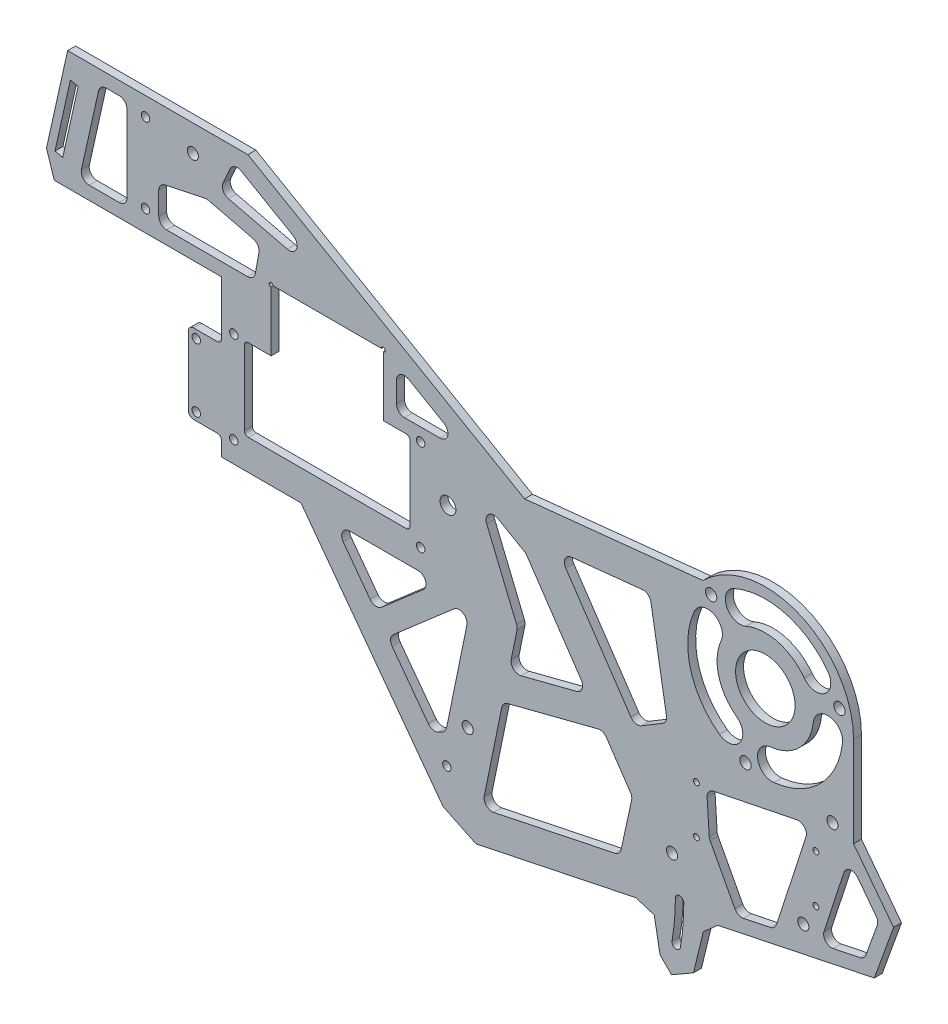
from build123d import *

# Parameters (mm, degrees)
SKETCH1_W           = 184.414327478
SKETCH1_H           = 83.61431582
BOSS_EXTRUDE1_DEPTH = 3
SKETCH2_R           = 3
CUT_EXTRUDE1_DEPTH  = 70
SKETCH3_R           = 11.25
CUT_EXTRUDE2_DEPTH  = 3
SKETCH4_R           = 1.6
BOSS_EXTRUDE2_DEPTH = 3
CUT_EXTRUDE3_DEPTH  = 10
SKETCH6_R           = 1.6
CUT_EXTRUDE4_DEPTH  = 3
FILLET1_R           = 1.5
SKETCH8_R           = 1.6
CUT_EXTRUDE6_DEPTH  = 12
SKETCH9_R           = 2.15
CUT_EXTRUDE7_DEPTH  = 12
BOSS_EXTRUDE3_DEPTH = 3
SKETCH12_R          = 1.6
CUT_EXTRUDE8_DEPTH  = 10
SKETCH13_R          = 1.1
CUT_EXTRUDE9_DEPTH  = 10
CUT_EXTRUDE10_START = -10
CUT_EXTRUDE10_DEPTH = 10
FILLET2_R           = 3
BOSS_EXTRUDE4_DEPTH = 3
SKETCH18_R          = 2.1
CUT_EXTRUDE11_DEPTH = 3
CUT_EXTRUDE12_DEPTH = 3
CUT_EXTRUDE13_DEPTH = 10
BOSS_EXTRUDE5_DEPTH = 3
CUT_EXTRUDE14_DEPTH = 10
BOSS_EXTRUDE7_DEPTH = 3
SKETCH24_W          = 17.029361635
SKETCH24_H          = 15.775010261
CUT_EXTRUDE15_DEPTH = 3
CUT_EXTRUDE16_DEPTH = 3
CUT_EXTRUDE17_DEPTH = 3
BOSS_EXTRUDE8_DEPTH = 3
BOSS_EXTRUDE9_DEPTH = 3
CUT_EXTRUDE18_DEPTH = 3
FILLET3_R           = 3


with BuildPart() as part:
    # Sketch1 → Boss-Extrude1 (new body)
    with BuildSketch(Plane.XY):
        with Locations((112.494062572, 5.79284209)):
            Rectangle(SKETCH1_W, SKETCH1_H)
    extrude(amount=BOSS_EXTRUDE1_DEPTH)

    # Sketch2 → Cut-Extrude1 (cut)
    with BuildSketch(Plane(origin=(0, 0, 0), x_dir=(-1, 0, 0), z_dir=(0, 0, -1))):
        with Locations((-24.116880081, 24)):
            Circle(SKETCH2_R)
    extrude(amount=-CUT_EXTRUDE1_DEPTH, mode=Mode.SUBTRACT)

    # Sketch3 → Cut-Extrude2 (cut)
    with BuildSketch(Plane.XY.offset(3)):
        with Locations((144.116880081, 24)):
            Circle(SKETCH3_R)
    extrude(amount=-CUT_EXTRUDE2_DEPTH, mode=Mode.SUBTRACT)

    # Sketch4 → Boss-Extrude2 (add)
    with BuildSketch(Plane.XY.offset(3)):
        with BuildLine():
            Line((-61.543119919, 56), (-61.543119919, 34))
            Line((-61.543119919, 34), (-72.043119919, 34))
            ThreePointArc((-72.043119919, 34), (-73.457333481, 33.414213562), (-74.043119919, 32))
            Line((-74.043119919, 32), (-74.043119919, 6))
            ThreePointArc((-74.043119919, 6), (-73.457333481, 4.585786438), (-72.043119919, 4))
            Line((-72.043119919, 4), (-61.543119919, 4))
            Line((-61.543119919, 4), (-61.543119919, -26))
            Line((-61.543119919, -26), (34.701226311, -81.566699204))
            Line((34.701226311, -81.566699204), (204.701226311, -81.566699204))
            Line((204.701226311, -81.566699204), (204.701226311, -36.01431582))
            Line((204.701226311, -36.01431582), (20.286898833, -36.01431582))
            Line((20.286898833, -36.01431582), (20.286898833, 47.6))
            Line((20.286898833, 47.6), (40.948393205, 47.6))
            Line((40.948393205, 47.6), (-51.543119919, 101))
            Line((-51.543119919, 101), (-121.543119919, 101))
            Line((-121.543119919, 101), (-121.543119919, 56))
            Line((-121.543119919, 56), (-61.543119919, 56))
        make_face()
        with Locations((-71.043119919, 31)):
            Circle(SKETCH4_R, mode=Mode.SUBTRACT)
        with Locations((-71.043119919, 7)):
            Circle(SKETCH4_R, mode=Mode.SUBTRACT)
    extrude(amount=-BOSS_EXTRUDE2_DEPTH)

    # Sketch5 → Cut-Extrude3 (cut)
    with BuildSketch(Plane.XY.offset(3)):
        with BuildLine():
            Line((-51.373138671, 8.5), (8.286898833, 8.5))
            ThreePointArc((8.286898833, 8.5), (9.347559005, 8.939339828), (9.786898833, 10))
            Line((9.786898833, 10), (9.786898833, 38))
            ThreePointArc((9.786898833, 38), (9.347559005, 39.060660172), (8.286898833, 39.5))
            Line((8.286898833, 39.5), (-0.343119919, 39.5))
            Line((-0.343119919, 39.5), (-0.343119919, 62.05))
            ThreePointArc((-0.343119919, 62.05), (0.187210167, 63.330330086), (-1.093119919, 62.8))
            Line((-1.093119919, 62.8), (-41.993119919, 62.8))
            ThreePointArc((-41.993119919, 62.8), (-43.273450005, 63.330330086), (-42.743119919, 62.05))
            Line((-42.743119919, 62.05), (-42.743119919, 39.5))
            Line((-42.743119919, 39.5), (-51.373138671, 39.5))
            ThreePointArc((-51.373138671, 39.5), (-52.433798843, 39.060660172), (-52.873138671, 38))
            Line((-52.873138671, 38), (-52.873138671, 10))
            ThreePointArc((-52.873138671, 10), (-52.433798843, 8.939339828), (-51.373138671, 8.5))
        make_face()
    extrude(amount=-CUT_EXTRUDE3_DEPTH, mode=Mode.SUBTRACT)

    # Sketch6 → Cut-Extrude4 (cut)
    with BuildSketch(Plane.XY.offset(3)):
        with Locations((13.786898833, 5)):
            Circle(SKETCH6_R)
        with Locations((13.786898833, 39.6)):
            Circle(SKETCH6_R)
        with Locations((-56.873138671, 5)):
            Circle(SKETCH6_R)
        with Locations((-56.873138671, 39.6)):
            Circle(SKETCH6_R)
    extrude(amount=-CUT_EXTRUDE4_DEPTH, mode=Mode.SUBTRACT)

    # Fillet1
    fillet1_edges = [part.edges().sort_by_distance(p)[0] for p in [
        (-61.543119919, 4, 1.5),
        (-61.543119919, 34, 1.5),
    ]]
    fillet(fillet1_edges, radius=FILLET1_R)

    # Sketch8 → Cut-Extrude6 (cut)
    with BuildSketch(Plane.XY.offset(3)):
        with Locations((-90.243119919, 94)):
            Circle(SKETCH8_R)
        with Locations((-90.243119919, 64)):
            Circle(SKETCH8_R)
    extrude(amount=-CUT_EXTRUDE6_DEPTH, mode=Mode.SUBTRACT)

    # Sketch9 → Cut-Extrude7 (cut)
    with BuildSketch(Plane(origin=(0, 0, 0), x_dir=(-1, 0, 0), z_dir=(0, 0, -1))):
        with Locations((-172.128729044, 31.505752308)):
            Circle(SKETCH9_R)
        with Locations((-123.610783427, 44.506096654)):
            Circle(SKETCH9_R)
        with Locations((-136.611127773, -4.011848962)):
            Circle(SKETCH9_R)
    extrude(amount=-CUT_EXTRUDE7_DEPTH, mode=Mode.SUBTRACT)

    # Sketch10 → Boss-Extrude3 (add)
    with BuildSketch(Plane(origin=(0, 0, 0), x_dir=(-1, 0, 0), z_dir=(0, 0, -1))):
        with BuildLine():
            Line((-167.680888654, 47.6), (-120.552871509, 47.6))
            ThreePointArc((-120.552871509, 47.6), (-144.116880081, 57.35), (-167.680888654, 47.6))
        make_face()
    extrude(amount=-BOSS_EXTRUDE3_DEPTH)

    # Sketch12 → Cut-Extrude8 (cut)
    with BuildSketch(Plane.XY.offset(3)):
        with Locations((23.701226311, -61.566699204)):
            Circle(SKETCH12_R)
        with BuildLine():
            ThreePointArc((110.101226311, -61.566699204), (109.784541603, -68.957425033), (108.836808989, -76.293971931))
            ThreePointArc((108.836808989, -76.293971931), (110.140666581, -78.143284068), (111.989978718, -76.839426476))
            ThreePointArc((111.989978718, -76.839426476), (112.97281254, -69.231155619), (113.301226311, -61.566699204))
            ThreePointArc((113.301226311, -61.566699204), (111.701226311, -59.966699204), (110.101226311, -61.566699204))
        make_face()
    extrude(amount=-CUT_EXTRUDE8_DEPTH, mode=Mode.SUBTRACT)

    # Sketch13 → Cut-Extrude9 (cut)
    with BuildSketch(Plane(origin=(0, 0, 0), x_dir=(-1, 0, 0), z_dir=(0, 0, -1))):
        with Locations((-163.256880081, -19.666699204)):
            Circle(SKETCH13_R)
        with Locations((-163.256880081, -37.666699204)):
            Circle(SKETCH13_R)
        with Locations((-118.056880081, -19.666699204)):
            Circle(SKETCH13_R)
        with Locations((-118.056880081, -37.666699204)):
            Circle(SKETCH13_R)
    extrude(amount=-CUT_EXTRUDE9_DEPTH, mode=Mode.SUBTRACT)

    # Sketch16 → Cut-Extrude10 (cut)
    with BuildSketch(Plane.XY.offset(3).offset(CUT_EXTRUDE10_START)):
        with BuildLine():
            Line((185.325635428, -50.178485254), (192.610066917, -29.966985111))
            Line((192.610066917, -29.966985111), (177.466624901, -10.155091534))
            Line((177.466624901, -10.155091534), (177.46688008, 23.999750834))
            ThreePointArc((177.46688008, 23.999750834), (174.923438362, 36.774132726), (167.680888654, 47.6))
            Line((167.680888654, 47.6), (204.701226311, 47.6))
            Line((204.701226311, 47.6), (204.701226311, -81.566699204))
            Line((204.701226311, -81.566699204), (109.015798372, -101.506327194))
            Line((109.015798372, -101.506327194), (-44.901184683, -81.566699204))
            Line((-44.901184683, -81.566699204), (-83.479855962, -7.179423821))
            Line((-83.479855962, -7.179423821), (-61.543119919, 0.5))
            Line((-61.543119919, 0.5), (-10.377615905, -59.783091395))
            Line((-10.377615905, -59.783091395), (34.701226311, -81.566699204))
            Line((34.701226311, -81.566699204), (95.172760947, -68.965199366))
            Line((95.172760947, -68.965199366), (102.113936995, -71.163480303))
            Line((102.113936995, -71.163480303), (104.337885566, -83.247775468))
            Line((104.337885566, -83.247775468), (107.080942415, -86.649887581))
            Line((107.080942415, -86.649887581), (116.929327033, -82.818994447))
            Line((116.929327033, -82.818994447), (120.691367686, -67.292179678))
            Line((120.691367686, -67.292179678), (126.176730317, -62.504365896))
            Line((126.176730317, -62.504365896), (185.325635428, -50.178485254))
        make_face()
        Polygon((181.569463907, -45.853814209), (186.98169326, -30.836956064), (175.587529072, -15.930175425), (164.707665864, -49.367598778), align=None)
        Polygon((147.786240628, -52.893808898), (133.646418373, -55.840368282), (122.940030102, -35.687729471), (121.928442119, -19.944750575), (161.094031546, -11.994559496), align=None)
        Polygon((89.166717868, -57.958999698), (93.826808725, -36.561374232), (82.859070044, -20.334560064), (44.843332342, -30.101550826), (36.922170316, -68.846099909), align=None)
        Polygon((76.913076188, -11.537437872), (47.071209453, -19.204400407), (50.404084791, -2.902404349), (35.32234623, 33.6), (46.404584615, 33.6), align=None)
        Polygon((94.86090031, -13.090702215), (107.087345897, -5.711274922), (100.36312134, 33.6), (63.30255402, 33.6), align=None)
        Polygon((12.323472505, -57.425373854), (22.136022596, -41.32020616), (30.031020571, -2.703632538), (-25.068997653, -30.11082242), (-11.765789474, -45.784634883), align=None)
        Polygon((-31.734510056, -22.257529442), (1.788643564, -5.582844635), (-2.128574469, 0.5), (-41.543119919, 0.5), (-41.543119919, -10.701045514), align=None)
        Polygon((32.317750709, 44.5), (4.656880081, 44.5), (4.656880081, 60.470011103), align=None)
        Polygon((-16.348136015, 72.5972628), (-56.880404544, 95.998578946), (-62.456657233, 83.781845933), align=None)
        Polygon((-49.161692729, 61), (-46.86151067, 73.82491911), (-67.080486661, 78.72945328), (-85.243119919, 74.895250525), (-85.243119919, 61), align=None)
    extrude(amount=CUT_EXTRUDE10_DEPTH, mode=Mode.SUBTRACT)

    # Fillet2
    fillet2_edges = [part.edges().sort_by_distance(p)[0] for p in [
        (175.587529072, -15.930175425, 1.5),
        (186.98169326, -30.836956064, 1.5),
        (164.707665864, -49.367598778, 1.5),
        (181.569463907, -45.853814209, 1.5),
        (121.928442119, -19.944750575, 1.5),
        (122.940030102, -35.687729471, 1.5),
        (133.646418373, -55.840368282, 1.5),
        (147.786240628, -52.893808898, 1.5),
        (94.86090031, -13.090702215, 1.5),
        (63.30255402, 33.6, 1.5),
        (35.32234623, 33.6, 1.5),
        (76.913076188, -11.537437872, 1.5),
        (89.166717868, -57.958999698, 1.5),
        (36.922170316, -68.846099909, 1.5),
        (50.404084791, -2.902404349, 1.5),
        (47.071209453, -19.204400407, 1.5),
        (93.826808725, -36.561374232, 1.5),
        (82.859070044, -20.334560064, 1.5),
        (107.087345897, -5.711274922, 1.5),
        (100.36312134, 33.6, 1.5),
        (161.094031546, -11.994559496, 1.5),
        (46.404584615, 33.6, 1.5),
        (30.031020571, -2.703632538, 1.5),
        (-25.068997653, -30.11082242, 1.5),
        (22.136022596, -41.32020616, 1.5),
        (12.323472505, -57.425373854, 1.5),
        (-11.765789474, -45.784634883, 1.5),
        (-41.543119919, -10.701045514, 1.5),
        (-31.734510056, -22.257529442, 1.5),
        (1.788643564, -5.582844635, 1.5),
        (-2.128574469, 0.5, 1.5),
        (-41.543119919, 0.5, 1.5),
        (4.656880081, 60.470011103, 1.5),
        (32.317750709, 44.5, 1.5),
        (4.656880081, 44.5, 1.5),
        (-85.243119919, 61, 1.5),
        (-46.86151067, 73.82491911, 1.5),
        (-49.161692729, 61, 1.5),
        (-67.080486661, 78.72945328, 1.5),
        (-85.243119919, 74.895250525, 1.5),
        (-56.880404544, 95.998578946, 1.5),
        (-62.456657233, 83.781845933, 1.5),
        (-16.348136015, 72.5972628, 1.5),
        (44.843332342, -30.101550826, 1.5),
    ]]
    fillet(fillet2_edges, radius=FILLET2_R)

    # Sketch17 → Boss-Extrude4 (add)
    with BuildSketch(Plane.XY.offset(3)):
        Polygon((34.701226311, -81.566699204), (-10.377615905, -59.783091395), (-17.438763163, -51.463662245), align=None)
    extrude(amount=-BOSS_EXTRUDE4_DEPTH)

    # Sketch18 → Cut-Extrude11 (cut)
    with BuildSketch(Plane.XY.offset(3)):
        with Locations((31.583807527, -45.033004622)):
            Circle(SKETCH18_R)
        with Locations((-72.352922935, 91)):
            Circle(SKETCH18_R)
        with Locations((108.840100712, -47.513424086)):
            Circle(SKETCH18_R)
        with Locations((158.466357649, -45.925703464)):
            Circle(SKETCH18_R)
        with Locations((169.466646726, -7.233826143)):
            Circle(SKETCH18_R)
    extrude(amount=-CUT_EXTRUDE11_DEPTH, mode=Mode.SUBTRACT)

    # Sketch19 → Cut-Extrude12 (cut)
    with BuildSketch(Plane.XY.offset(3)):
        with BuildLine():
            ThreePointArc((158.83225844, 34.794449489), (166.590041703, 33.602057421), (167.78243377, 41.359840685))
            ThreePointArc((167.78243377, 41.359840685), (151.713219055, 52.349923002), (132.301829734, 50.866839883))
            ThreePointArc((132.301829734, 50.866839883), (129.455579924, 43.552206466), (136.770213341, 40.705956656))
            ThreePointArc((136.770213341, 40.705956656), (148.840327654, 41.62814633), (158.83225844, 34.794449489))
        make_face()
        with BuildLine():
            ThreePointArc((147.318166275, -5.174891032), (164.870464109, 3.246415972), (173.291771113, 20.798713806))
            ThreePointArc((173.291771113, 20.798713806), (168.38023766, 26.920955155), (162.25799631, 22.009421702))
            ThreePointArc((162.25799631, 22.009421702), (157.021578838, 11.095301243), (146.107458379, 5.858883771))
            ThreePointArc((146.107458379, 5.858883771), (141.195924926, -0.263357578), (147.318166275, -5.174891032))
        make_face()
        with BuildLine():
            ThreePointArc((127.410923425, 31.346666741), (124.564673615, 38.661300157), (117.250040198, 35.815050347))
            ThreePointArc((117.250040198, 35.815050347), (115.76695708, 16.403661026), (126.757039397, 0.334446311))
            ThreePointArc((126.757039397, 0.334446311), (134.51482266, 1.526838378), (133.322430592, 9.284621641))
            ThreePointArc((133.322430592, 9.284621641), (126.488733751, 19.276552427), (127.410923425, 31.346666741))
        make_face()
    extrude(amount=-CUT_EXTRUDE12_DEPTH, mode=Mode.SUBTRACT)

    # Sketch20 → Cut-Extrude13 (cut)
    with BuildSketch(Plane.XY.offset(3)):
        Polygon((-118.598446043, 56), (-121.543119919, 65.062774312), (-121.543119919, 56), align=None)
        Polygon((-113.543119919, 101), (-121.543119919, 101), (-121.543119919, 65.062774312), align=None)
    extrude(amount=-CUT_EXTRUDE13_DEPTH, mode=Mode.SUBTRACT)

    # Sketch21 → Boss-Extrude5 (add)
    with BuildSketch(Plane.XY.offset(3)):
        Polygon((117.232749576, -81.566699204), (116.96645292, -82.665767299), (108.657506969, -87.46293948), (104.314325759, -83.11975827), (104.028506566, -81.566699204), align=None)
    extrude(amount=-BOSS_EXTRUDE5_DEPTH)

    # Sketch22 → Cut-Extrude14 (cut)
    with BuildSketch(Plane.XY.offset(3)):
        Polygon((22.245960614, -75.547897261), (-29.744865769, -5.321611699), (-61.543119919, -5.321611699), (-61.543119919, 0.5), (-101.253001454, -52.956248508), align=None)
    extrude(amount=-CUT_EXTRUDE14_DEPTH, mode=Mode.SUBTRACT)

    # Sketch23 → Boss-Extrude7 (add)
    with BuildSketch(Plane.XY.offset(3)):
        Polygon((22.245960614, -75.547897261), (-31.463631183, -3), (-61.543119919, -3), (-61.543119919, 0.5), (0.079563838, 0.5), (9.364923533, -1.406610369), (34.185770163, 1.811340502), (25.985988108, -38.122317169), (19.932958192, -56.258720546), align=None)
    extrude(amount=-BOSS_EXTRUDE7_DEPTH)

    # Sketch24 → Cut-Extrude15 (cut)
    with BuildSketch(Plane.XY.offset(3)):
        with Locations((-50.057800737, -10.887505131)):
            Rectangle(SKETCH24_W, SKETCH24_H)
    extrude(amount=-CUT_EXTRUDE15_DEPTH, mode=Mode.SUBTRACT)

    # Sketch25 → Cut-Extrude16 (cut)
    with BuildSketch(Plane.XY.offset(3)):
        with BuildLine():
            Line((16.675157033, -51.216894022), (2.995479824, -32.739155066))
            ThreePointArc((2.995479824, -32.739155066), (2.424525914, -30.626839071), (3.440002978, -28.688625057))
            Line((3.440002978, -28.688625057), (26.355673645, -8.796002503))
            ThreePointArc((26.355673645, -8.796002503), (29.835741353, -8.471220063), (31.261494647, -11.662392642))
            Line((31.261494647, -11.662392642), (23.59441239, -49.164168752))
            ThreePointArc((23.59441239, -49.164168752), (23.073231646, -50.338978364), (22.108261474, -51.187883282))
            Line((22.108261474, -51.187883282), (20.539350273, -52.056468682))
            ThreePointArc((20.539350273, -52.056468682), (18.449348554, -52.363449137), (16.675157033, -51.216894022))
        make_face()
        with BuildLine():
            Line((-0.982133366, -21.933620712), (14.763128686, -8.265482452))
            ThreePointArc((14.763128686, -8.265482452), (15.606887802, -4.950344665), (12.796509948, -3))
            Line((12.796509948, -3), (-13.067723904, -3))
            ThreePointArc((-13.067723904, -3), (-15.746822882, -4.650026421), (-15.478865795, -7.785047557))
            Line((-15.478865795, -7.785047557), (-5.359893995, -21.453185817))
            ThreePointArc((-5.359893995, -21.453185817), (-3.276020542, -22.650234062), (-0.982133366, -21.933620712))
        make_face()
    extrude(amount=-CUT_EXTRUDE16_DEPTH, mode=Mode.SUBTRACT)

    # Sketch26 → Cut-Extrude17 (cut)
    with BuildSketch(Plane.XY.offset(3)):
        Polygon((40.948393205, 47.6), (53.072748858, 40.6), (120.552871509, 47.6), align=None)
    extrude(amount=-CUT_EXTRUDE17_DEPTH, mode=Mode.SUBTRACT)

    # Sketch27 → Boss-Extrude8 (add)
    with BuildSketch(Plane.XY.offset(3)):
        with BuildLine():
            Line((101.250531044, 28.412010432), (100.863259918, 30.676081417))
            ThreePointArc((100.863259918, 30.676081417), (99.719401901, 32.56032239), (97.59666556, 33.154263158))
            Line((97.59666556, 33.154263158), (70.810270819, 30.375596555))
            ThreePointArc((70.810270819, 30.375596555), (68.401141551, 28.660004425), (68.634306829, 25.711649945))
            Line((68.634306829, 25.711649945), (74.246041606, 17.409065426))
            Line((74.246041606, 17.409065426), (55.517456287, 34.991473507))
            Line((55.517456287, 34.991473507), (110.102363214, 37.946841418))
            Line((110.102363214, 37.946841418), (101.250531044, 28.412010432))
        make_face()
        with BuildLine():
            Line((43.004090461, 29.09263456), (52.97851836, 23.333895928))
            ThreePointArc((52.97851836, 23.333895928), (53.523463091, 22.930859818), (53.964024103, 22.415778407))
            Line((53.964024103, 22.415778407), (60.830105813, 12.257382477))
            Line((60.830105813, 12.257382477), (47.398285526, 37.946841418))
            Line((47.398285526, 37.946841418), (28.883739191, 36.026248816))
            Line((28.883739191, 36.026248816), (40.801126272, 20.339682323))
            Line((40.801126272, 20.339682323), (38.731431053, 25.348975611))
            ThreePointArc((38.731431053, 25.348975611), (39.527057059, 28.750957898), (43.004090461, 29.09263456))
        make_face()
    extrude(amount=-BOSS_EXTRUDE8_DEPTH)

    # Sketch28 → Boss-Extrude9 (add)
    with BuildSketch(Plane.XY.offset(3)):
        Polygon((-124.745314673, 56), (-118.598446043, 56), (-121.543119919, 65.062774312), (-124.471440187, 65.714648843), (-118.644355292, 91.890806969), (-115.716035023, 91.238932438), (-113.543119919, 101), (-119.68998855, 101), (-127.68998855, 65.062774312), align=None)
    extrude(amount=-BOSS_EXTRUDE9_DEPTH)

    # Sketch29 → Cut-Extrude18 (cut)
    with BuildSketch(Plane.XY.offset(3)):
        Polygon((-97.243119919, 61), (-115.276188977, 61), (-107.484825157, 96), (-97.243119919, 96), align=None)
    extrude(amount=-CUT_EXTRUDE18_DEPTH, mode=Mode.SUBTRACT)

    # Fillet3
    fillet3_edges = [part.edges().sort_by_distance(p)[0] for p in [
        (-107.484825157, 96, 1.5),
        (-97.243119919, 96, 1.5),
        (-97.243119919, 61, 1.5),
        (-115.276188977, 61, 1.5),
    ]]
    fillet(fillet3_edges, radius=FILLET3_R)


solid = part.part
